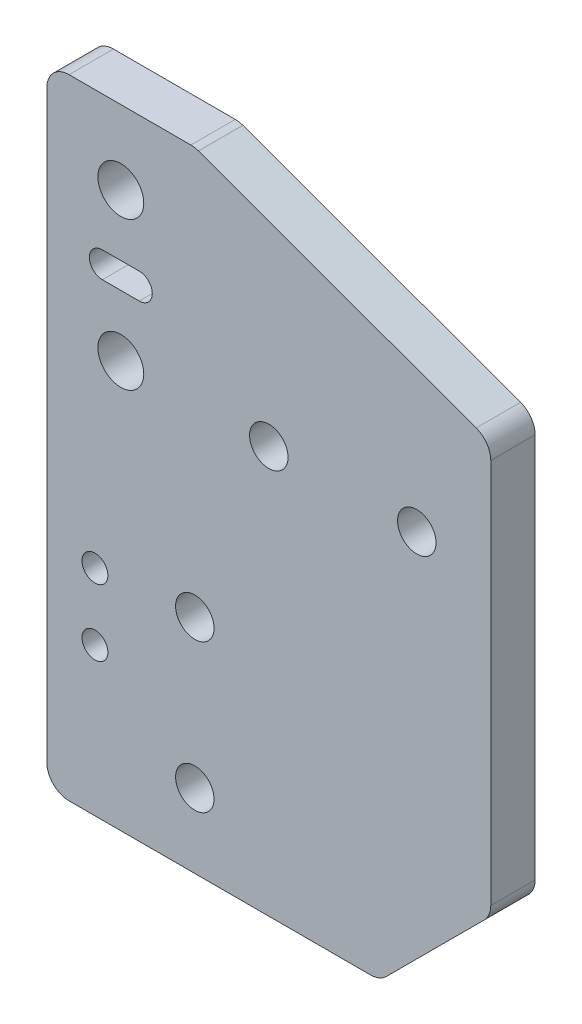
from build123d import *

# Parameters (mm, degrees)
MODEL_R                  = 3.1
MODEL_R_2                = 2.6
BODY_DEPTH               = 6
SKETCH3_R                = 1.75
CABLEMOUNT_DEPTH         = 105.216121594
F_5_1_5_1_FOOTINGMOUNT_D = 5.2


with BuildPart() as part:
    # Model → Body (new body)
    with BuildSketch(Plane.XY):
        with BuildLine():
            Line((59.121320344, 14.121320344), (45.878679656, 0.878679656))
            ThreePointArc((45.878679656, 0.878679656), (44.90540961, 0.228361402), (43.757359313, 0))
            Line((43.757359313, 0), (3, 0))
            ThreePointArc((3, 0), (0.878679656, 0.878679656), (0, 3))
            Line((0, 3), (0, 82))
            ThreePointArc((0, 82), (0.878679656, 84.121320344), (3, 85))
            Line((3, 85), (19.471019058, 85))
            ThreePointArc((19.471019058, 85), (19.991963591, 84.954423259), (20.497079488, 84.819077862))
            Line((20.497079488, 84.819077862), (58.02606043, 71.159645877))
            ThreePointArc((58.02606043, 71.159645877), (59.457456133, 70.061297324), (60, 68.340568015))
            Line((60, 68.340568015), (60, 16.242640687))
            ThreePointArc((60, 16.242640687), (59.771638598, 15.09459039), (59.121320344, 14.121320344))
        make_face()
        with Locations((10, 75)):
            Circle(MODEL_R, mode=Mode.SUBTRACT)
        with Locations((10, 55)):
            Circle(MODEL_R, mode=Mode.SUBTRACT)
        with Locations((30, 55)):
            Circle(MODEL_R_2, mode=Mode.SUBTRACT)
        with Locations((50, 55)):
            Circle(MODEL_R_2, mode=Mode.SUBTRACT)
        with BuildLine():
            Line((12.5, 63.25), (7.5, 63.25))
            ThreePointArc((7.5, 63.25), (5.75, 65), (7.5, 66.75))
            Line((7.5, 66.75), (12.5, 66.75))
            ThreePointArc((12.5, 66.75), (14.25, 65), (12.5, 63.25))
        make_face(mode=Mode.SUBTRACT)
    extrude(amount=BODY_DEPTH)

    # Sketch3 → CableMount (cut, through all)
    with BuildSketch(Plane.XY.offset(6)):
        with Locations((6.5, 29)):
            Circle(SKETCH3_R)
        with Locations((6.5, 20)):
            Circle(SKETCH3_R)
    extrude(amount=-CABLEMOUNT_DEPTH, mode=Mode.SUBTRACT)

    # Ø5.1 (5.1) FootingMount (through all)
    with Locations(Plane.XY.offset(6)):
        with Locations((20, 10), (20, 30)):
            Hole(F_5_1_5_1_FOOTINGMOUNT_D / 2)


solid = part.part
